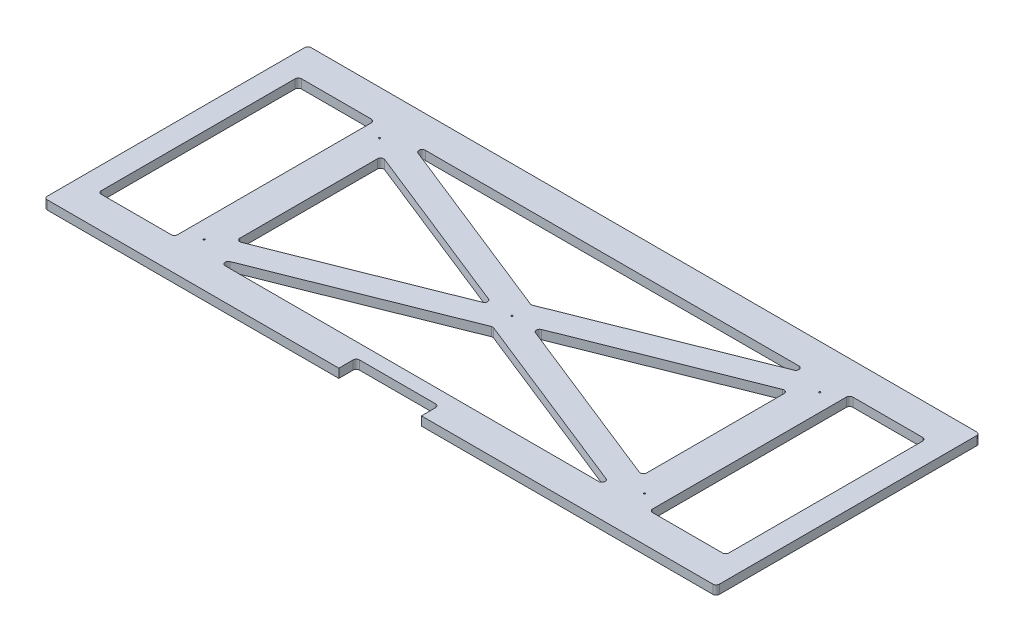
from build123d import *

# Parameters (mm, degrees)
SKETCH1_W                    = 1343.025
SKETCH1_H                    = 527.05
BOSS_EXTRUDE1_DEPTH          = 17.78
FILLET1_R                    = 6.35
SKETCH5_W                    = 152.4
SKETCH5_H                    = 400.05
CUT_EXTRUDE1_DEPTH           = 722.588935393
FILLET2_R                    = 6.35
F_1_8_0_125_DIAMETER_HOLE2_D = 3.175
CUT_EXTRUDE2_DEPTH           = 722.588935393


with BuildPart() as part:
    # Sketch1 → Boss-Extrude1 (new body)
    with BuildSketch(Plane(origin=(0, 0, 0), x_dir=(1, 0, 0), z_dir=(0, 1, 0))):
        Rectangle(SKETCH1_W, SKETCH1_H)
    extrude(amount=BOSS_EXTRUDE1_DEPTH)

    # Fillet1
    fillet1_edges = [part.edges().sort_by_distance(p)[0] for p in [
        (-671.5125, 8.89, 263.525),
        (-671.5125, 8.89, -263.525),
        (671.5125, 8.89, -263.525),
        (671.5125, 8.89, 263.525),
    ]]
    fillet(fillet1_edges, radius=FILLET1_R)

    # Sketch5 → Cut-Extrude1 (cut, through all)
    with BuildSketch(Plane(origin=(0, 17.78, 0), x_dir=(1, 0, 0), z_dir=(0, 1, 0))):
        Polygon((-406.4, 200.025), (406.4, 200.025), (0, 38.1), align=None)
        Polygon((0, -38.1), (-406.4, -200.025), (406.4, -200.025), align=None)
        Polygon((406.4, 146.74453125), (406.4, -146.74453125), (38.1, 0), align=None)
        Polygon((-406.4, 146.74453125), (-38.1, 0), (-406.4, -146.74453125), align=None)
        with Locations((550.8625, 0)):
            Rectangle(SKETCH5_W, SKETCH5_H)
        with Locations((-550.8625, 0)):
            Rectangle(SKETCH5_W, SKETCH5_H)
    extrude(amount=-CUT_EXTRUDE1_DEPTH, mode=Mode.SUBTRACT)

    # Fillet2
    fillet2_edges = [part.edges().sort_by_distance(p)[0] for p in [
        (474.6625, 8.89, -200.025),
        (474.6625, 8.89, 200.025),
        (627.0625, 8.89, 200.025),
        (406.4, 8.89, 146.74453125),
        (406.4, 8.89, 200.025),
        (627.0625, 8.89, -200.025),
        (406.4, 8.89, -146.74453125),
        (406.4, 8.89, -200.025),
        (38.1, 8.89, 0),
        (0, 8.89, 38.1),
        (0, 8.89, -38.1),
        (-38.1, 8.89, 0),
        (-406.4, 8.89, 200.025),
        (-406.4, 8.89, -200.025),
        (-406.4, 8.89, -146.74453125),
        (-406.4, 8.89, 146.74453125),
        (-627.0625, 8.89, 200.025),
        (-474.6625, 8.89, 200.025),
        (-474.6625, 8.89, -200.025),
        (-627.0625, 8.89, -200.025),
    ]]
    fillet(fillet2_edges, radius=FILLET2_R)

    # 1/8 (0.125) Diameter Hole2 (through all)
    with Locations(Plane(origin=(0, 17.78, 0), x_dir=(1, 0, 0), z_dir=(0, 1, 0))):
        with Locations((0, 0), (-439.865615282, -175.258956089), (439.865615282, 175.258956089), (439.865615282, -175.258956089), (-439.865615282, 175.258956089)):
            Hole(F_1_8_0_125_DIAMETER_HOLE2_D / 2)

    # Sketch8 → Cut-Extrude2 (cut, through all)
    with BuildSketch(Plane(origin=(0, 17.78, 0), x_dir=(1, 0, 0), z_dir=(0, 1, 0))):
        with BuildLine():
            Line((-82.55, -263.525), (-82.55, -234.95))
            ThreePointArc((-82.55, -234.95), (-80.690128061, -230.459871939), (-76.2, -228.6))
            Line((-76.2, -228.6), (76.2, -228.6))
            ThreePointArc((76.2, -228.6), (80.690128061, -230.459871939), (82.55, -234.95))
            Line((82.55, -234.95), (82.55, -263.525))
            Line((82.55, -263.525), (-82.55, -263.525))
        make_face()
    extrude(amount=-CUT_EXTRUDE2_DEPTH, mode=Mode.SUBTRACT)


solid = part.part
